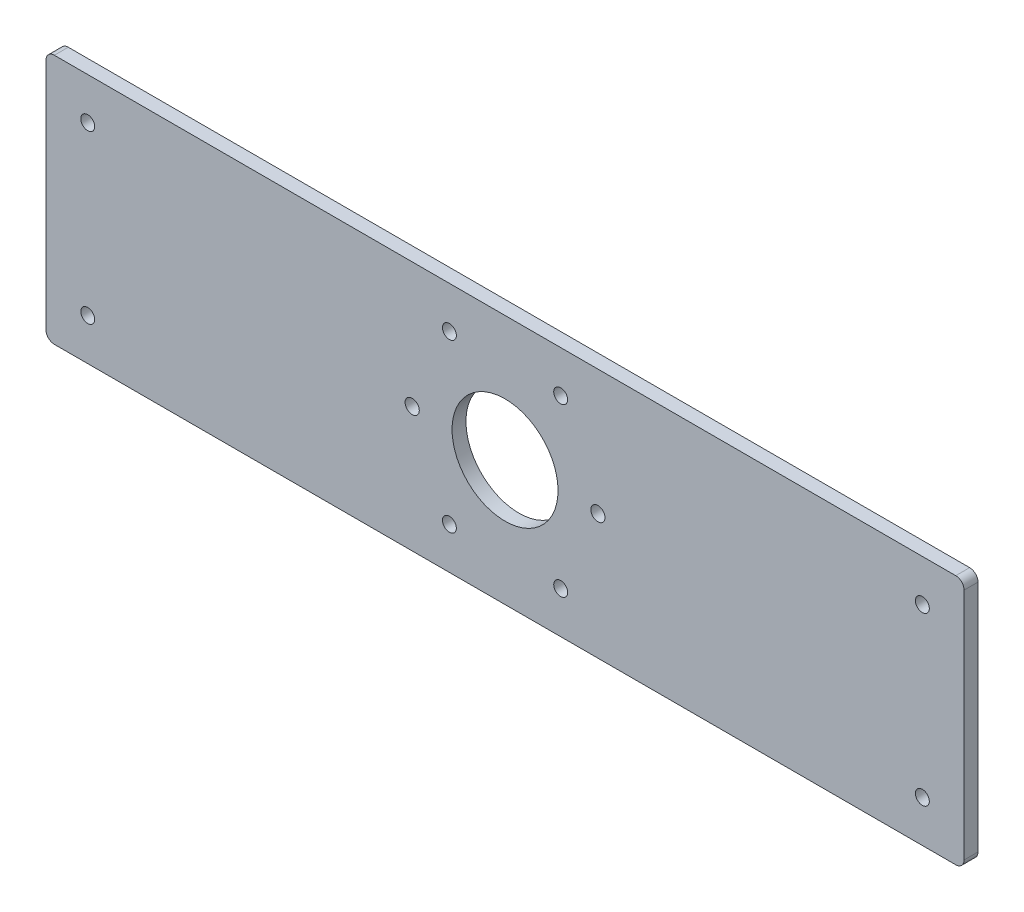
from build123d import *

# Parameters (mm, degrees)
SKETCH1_W           = 330
SKETCH1_H           = 90
SKETCH1_R           = 19.05
SKETCH1_R_2         = 2.55
BOSS_EXTRUDE1_DEPTH = 2.5
SKETCH2_R           = 2.5
CUT_EXTRUDE1_DEPTH  = 172.099386323
FILLET1_R           = 3


with BuildPart() as part:
    # Sketch1 → Boss-Extrude1 (new, symmetric)
    with BuildSketch(Plane.XY):
        Rectangle(SKETCH1_W, SKETCH1_H)
        Circle(SKETCH1_R, mode=Mode.SUBTRACT)
        with Locations((-33.375440072, 0)):
            Circle(SKETCH1_R_2, mode=Mode.SUBTRACT)
        with Locations((33.375440072, 0)):
            Circle(SKETCH1_R_2, mode=Mode.SUBTRACT)
    extrude(amount=BOSS_EXTRUDE1_DEPTH, both=True)

    # Sketch2 → Cut-Extrude1 (cut, through all)
    with BuildSketch(Plane.XY.offset(2.5)):
        with Locations((-150, 30)):
            Circle(SKETCH2_R)
        with Locations((-150, -30)):
            Circle(SKETCH2_R)
        with Locations((-20, 30)):
            Circle(SKETCH2_R)
        with Locations((-20, -30)):
            Circle(SKETCH2_R)
        with Locations((20, -30)):
            Circle(SKETCH2_R)
        with Locations((20, 30)):
            Circle(SKETCH2_R)
        with Locations((150, 30)):
            Circle(SKETCH2_R)
        with Locations((150, -30)):
            Circle(SKETCH2_R)
    extrude(amount=-CUT_EXTRUDE1_DEPTH, mode=Mode.SUBTRACT)

    # Fillet1
    fillet1_edges = [part.edges().sort_by_distance(p)[0] for p in [
        (-165, -45, 0),
        (165, -45, 0),
        (165, 45, 0),
        (-165, 45, 0),
    ]]
    fillet(fillet1_edges, radius=FILLET1_R)


solid = part.part
